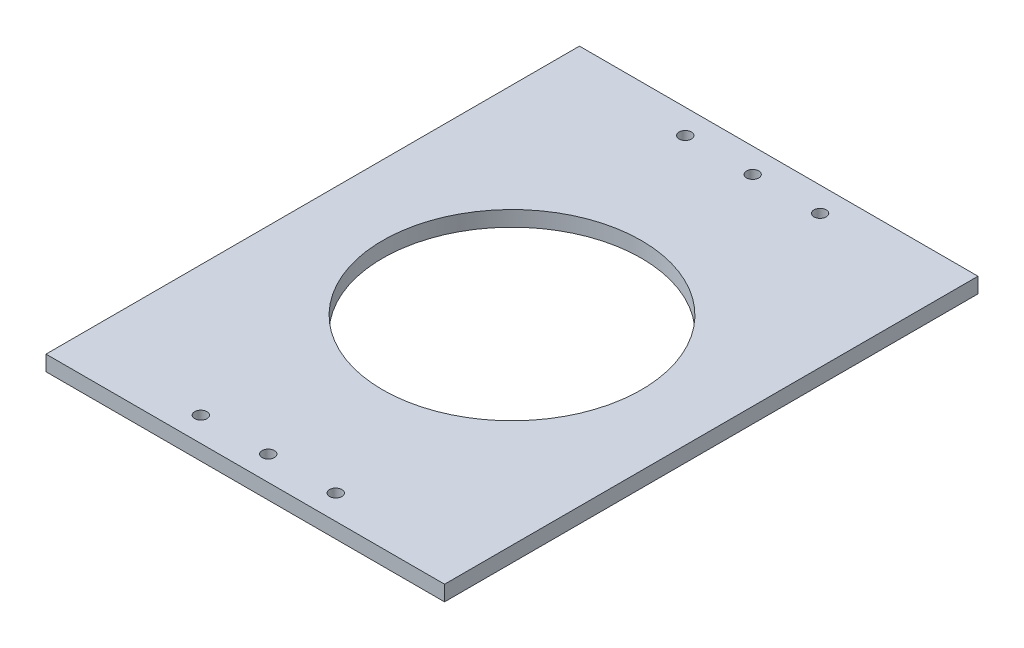
from build123d import *

# Parameters (mm, degrees)
SKETCH1_W           = 130
SKETCH1_H           = 174
SKETCH1_R           = 42.197881281
SKETCH1_R_2         = 2
BOSS_EXTRUDE1_DEPTH = 5


with BuildPart() as part:
    # Sketch1 → Boss-Extrude1 (new body)
    with BuildSketch(Plane(origin=(0, 0, 0), x_dir=(1, 0, 0), z_dir=(0, 1, 0))):
        with Locations((-276.66296023, 28.424722657)):
            Rectangle(SKETCH1_W, SKETCH1_H)
        with Locations((-276.66296023, 28.424722657)):
            Circle(SKETCH1_R, mode=Mode.SUBTRACT)
        with Locations((-299.16296023, 107.424722657)):
            Circle(SKETCH1_R_2, mode=Mode.SUBTRACT)
        with Locations((-277.16296023, 107.424722657)):
            Circle(SKETCH1_R_2, mode=Mode.SUBTRACT)
        with Locations((-255.16296023, 107.424722657)):
            Circle(SKETCH1_R_2, mode=Mode.SUBTRACT)
        with Locations((-255.16296023, -50.575277343)):
            Circle(SKETCH1_R_2, mode=Mode.SUBTRACT)
        with Locations((-277.16296023, -50.575277343)):
            Circle(SKETCH1_R_2, mode=Mode.SUBTRACT)
        with Locations((-299.16296023, -50.575277343)):
            Circle(SKETCH1_R_2, mode=Mode.SUBTRACT)
    extrude(amount=BOSS_EXTRUDE1_DEPTH)


solid = part.part
